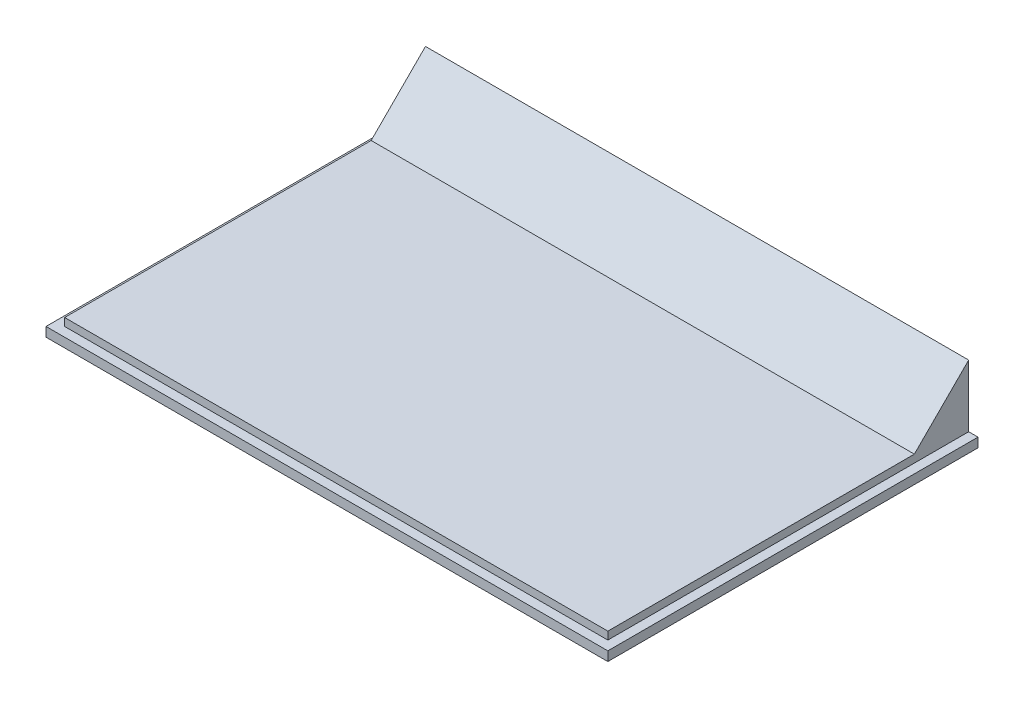
from build123d import *

# Parameters (mm, degrees)
SKICA2_W                = 72.4
SKICA2_H                = 47.7
P_IDAT_VYSUNUT_M1_DEPTH = 1.2
SKICA3_W                = 70
SKICA3_H                = 46.5
P_IDAT_VYSUNUT_M2_DEPTH = 1
SKICA4_W                = 70
SKICA4_H                = 7
P_IDAT_VYSUNUT_M3_DEPTH = 7
ZKOSEN_2_SIZE           = 7


with BuildPart() as part:
    # Skica2 → Přidat vysunutím1 (new body)
    with BuildSketch(Plane(origin=(0, 0, 0), x_dir=(1, 0, 0), z_dir=(0, 1, 0))):
        with Locations((36.2, 23.85)):
            Rectangle(SKICA2_W, SKICA2_H)
    extrude(amount=P_IDAT_VYSUNUT_M1_DEPTH)

    # Skica3 → Přidat vysunutím2 (add)
    with BuildSketch(Plane(origin=(0, 1.2, 0), x_dir=(1, 0, 0), z_dir=(0, 1, 0))):
        with Locations((36.2, 24.45)):
            Rectangle(SKICA3_W, SKICA3_H)
    extrude(amount=P_IDAT_VYSUNUT_M2_DEPTH)

    # Skica4 → Přidat vysunutím3 (add)
    with BuildSketch(Plane(origin=(0, 2.2, 0), x_dir=(1, 0, 0), z_dir=(0, 1, 0))):
        with Locations((36.2, 44.2)):
            Rectangle(SKICA4_W, SKICA4_H)
    extrude(amount=P_IDAT_VYSUNUT_M3_DEPTH)

    # Zkosení2
    zkosen_2_edges = [part.edges().sort_by_distance(p)[0] for p in [
        (36.2, 9.2, -40.7),
    ]]
    chamfer(zkosen_2_edges, length=ZKOSEN_2_SIZE - 0.0001)  # a hair under: the kernel refuses the full size


solid = part.part
